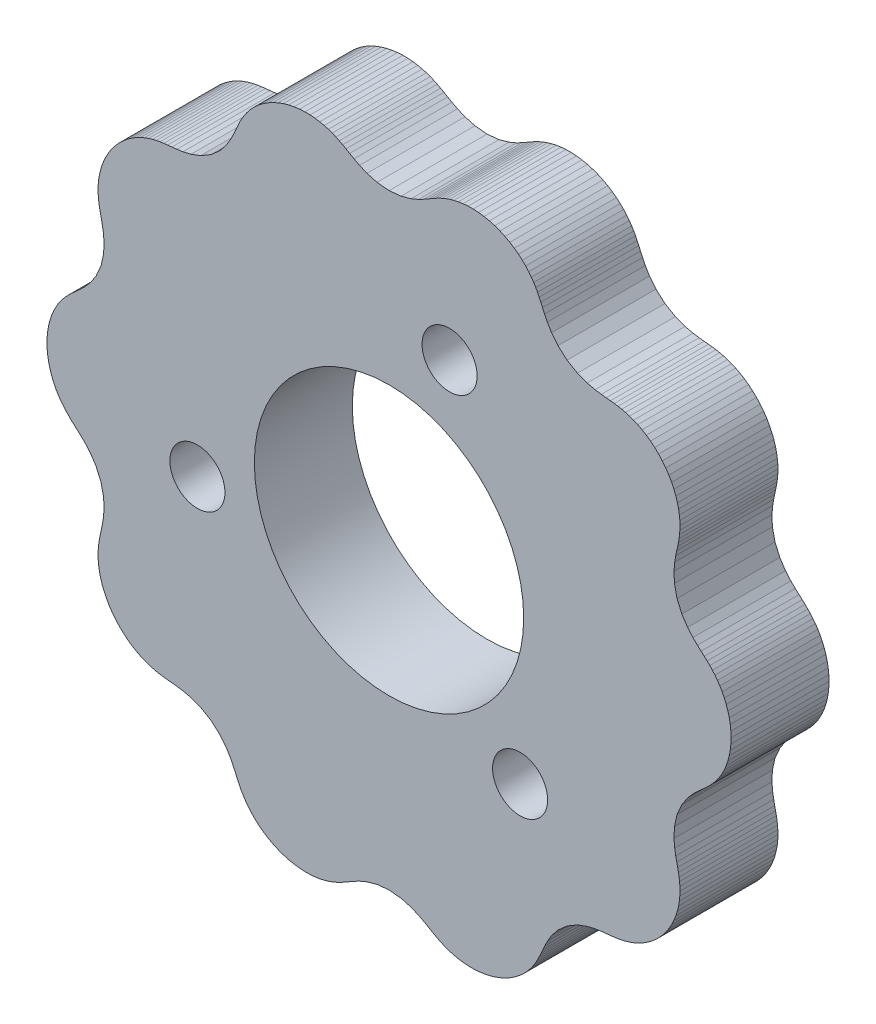
from build123d import *

# Parameters (mm, degrees)
MODEL_R             = 8.73125
BOSS_EXTRUDE1_DEPTH = 6.35
SKETCH2_R           = 1.78435
CUT_EXTRUDE1_DEPTH  = 33.323771723
SKETCH3_R           = 3.175
CUT_EXTRUDE2_DEPTH  = 3.81


with BuildPart() as part:
    # Model → Boss-Extrude1 (new body)
    with BuildSketch(Plane.XY):
        Polygon((20.890931284, -0.361246536), (20.90416592, 0), (20.890931284, 0.361246536), (20.851630676, 0.717938171), (20.787453815, 1.065699726), (20.70031633, 1.40051076), (20.592758773, 1.718871579), (20.467804656, 2.017956811), (20.328775926, 2.29575465), (20.179062376, 2.551192441), (20.021838, 2.784253604), (19.859711664, 2.996098554), (19.694291065, 3.189216289), (19.525628153, 3.36766), (19.351506826, 3.537471764), (19.166554614, 3.707500416), (18.961299064, 3.890989773), (18.721830857, 4.10851653), (18.432408361, 4.392542238), (18.086923383, 4.790426506), (17.715401805, 5.350520314), (17.403006197, 6.067227501), (17.234469638, 6.830677327), (17.205822028, 7.50217764), (17.251454741, 8.02714375), (17.318656337, 8.42704365), (17.384531166, 8.743782373), (17.442734057, 9.012874567), (17.492423206, 9.259142818), (17.533477467, 9.498869369), (17.565042048, 9.742370936), (17.585358367, 9.995838254), (17.59200199, 10.262519888), (17.582209268, 10.543484499), (17.553187508, 10.83813743), (17.502378641, 11.14459964), (17.427670756, 11.460010862), (17.327558853, 11.780790921), (17.201257572, 12.102876866), (17.048768629, 12.421944087), (16.870905406, 12.733613999), (16.669277065, 13.033647709), (16.446234634, 13.318123173), (16.204781691, 13.583592449), (15.948452407, 13.827215245), (15.681159712, 14.046864933), (15.407016027, 14.2412035), (15.130128134, 14.409722348), (14.854366055, 14.552746484), (14.583102683, 14.671400581), (14.318915576, 14.767536853), (14.063233278, 14.843627549), (13.815893445, 14.902631289), (13.574555701, 14.947857711), (13.333875739, 14.982892367), (13.084305922, 15.011736253), (12.810398356, 15.039536075), (12.488805487, 15.074763039), (12.087711646, 15.134426388), (11.574337923, 15.253250548), (10.944555773, 15.488001053), (10.270552502, 15.884207816), (9.685459013, 16.402788395), (9.267584629, 16.929204918), (8.995934932, 17.380733658), (8.815246902, 17.74375958), (8.682366407, 18.038726843), (8.571285112, 18.290637801), (8.466731632, 18.519079551), (8.359037495, 18.737153494), (8.241447148, 18.952703595), (8.108899044, 19.169704596), (7.957522317, 19.389359593), (7.784452983, 19.610908721), (7.587781239, 19.832229386), (7.366542034, 20.05029782), (7.120708021, 20.261558666), (6.851166002, 20.462230885), (6.559668751, 20.648565858), (6.248759598, 20.81706591), (5.92167025, 20.964666786), (5.582194105, 21.088884991), (5.234538506, 21.187929424), (4.883160046, 21.260776101), (4.532587413, 21.30720451), (4.187236233, 21.327794136), (3.851219989, 21.323879725), (3.528160084, 21.297463717), (3.220996399, 21.25108379), (2.931796592, 21.187632361), (2.66155725, 21.110122954), (2.409980937, 21.021395336), (2.17519728, 20.923747659), (1.95336752, 20.818481836), (1.738060486, 20.705357335), (1.519200252, 20.581999072), (1.281264051, 20.443490772), (1.000384065, 20.282962439), (0.640823095, 20.095474058), (0.155651939, 19.889851319), (-0.491835408, 19.709591807), (-1.27, 19.63396063), (-2.048164592, 19.709591807), (-2.695651939, 19.889851319), (-3.180823095, 20.095474058), (-3.540384065, 20.282962439), (-3.821264051, 20.443490772), (-4.059200252, 20.581999072), (-4.278060486, 20.705357335), (-4.49336752, 20.818481836), (-4.71519728, 20.923747659), (-4.949980937, 21.021395336), (-5.20155725, 21.110122954), (-5.471796592, 21.187632361), (-5.760996399, 21.25108379), (-6.068160084, 21.297463717), (-6.391219989, 21.323879725), (-6.727236233, 21.327794136), (-7.072587413, 21.30720451), (-7.423160046, 21.260776101), (-7.774538506, 21.187929424), (-8.122194105, 21.088884991), (-8.46167025, 20.964666786), (-8.788759598, 20.81706591), (-9.099668751, 20.648565858), (-9.391166002, 20.462230885), (-9.660708021, 20.261558666), (-9.906542034, 20.05029782), (-10.127781239, 19.832229386), (-10.324452983, 19.610908721), (-10.497522317, 19.389359593), (-10.648899044, 19.169704596), (-10.781447148, 18.952703595), (-10.899037495, 18.737153494), (-11.006731632, 18.519079551), (-11.111285112, 18.290637801), (-11.222366407, 18.038726843), (-11.355246902, 17.74375958), (-11.535934932, 17.380733658), (-11.807584629, 16.929204918), (-12.225459013, 16.402788395), (-12.810552502, 15.884207816), (-13.484555773, 15.488001053), (-14.114337923, 15.253250548), (-14.627711646, 15.134426388), (-15.028805487, 15.074763039), (-15.350398356, 15.039536075), (-15.624305922, 15.011736253), (-15.873875739, 14.982892367), (-16.114555701, 14.947857711), (-16.355893445, 14.902631289), (-16.603233278, 14.843627549), (-16.858915576, 14.767536853), (-17.123102683, 14.671400581), (-17.394366055, 14.552746484), (-17.670128134, 14.409722348), (-17.947016027, 14.2412035), (-18.221159712, 14.046864933), (-18.488452407, 13.827215245), (-18.744781691, 13.583592449), (-18.986234634, 13.318123173), (-19.209277065, 13.033647709), (-19.410905406, 12.733613999), (-19.588768629, 12.421944087), (-19.741257572, 12.102876866), (-19.867558853, 11.780790921), (-19.967670756, 11.460010862), (-20.042378641, 11.14459964), (-20.093187508, 10.83813743), (-20.122209268, 10.543484499), (-20.13200199, 10.262519888), (-20.125358367, 9.995838254), (-20.105042048, 9.742370936), (-20.073477467, 9.498869369), (-20.032423206, 9.259142818), (-19.982734057, 9.012874567), (-19.924531166, 8.743782373), (-19.858656337, 8.42704365), (-19.791454741, 8.02714375), (-19.745822028, 7.50217764), (-19.774469638, 6.830677327), (-19.943006197, 6.067227501), (-20.255401805, 5.350520314), (-20.626923383, 4.790426506), (-20.972408361, 4.392542238), (-21.261830857, 4.10851653), (-21.501299064, 3.890989773), (-21.706554614, 3.707500416), (-21.891506826, 3.537471764), (-22.065628153, 3.36766), (-22.234291065, 3.189216289), (-22.399711664, 2.996098554), (-22.561838, 2.784253604), (-22.719062376, 2.551192441), (-22.868775926, 2.29575465), (-23.007804656, 2.017956811), (-23.132758773, 1.718871579), (-23.24031633, 1.40051076), (-23.327453815, 1.065699726), (-23.391630676, 0.717938171), (-23.430931284, 0.361246536), (-23.44416592, 0), (-23.430931284, -0.361246536), (-23.391630676, -0.717938171), (-23.327453815, -1.065699726), (-23.24031633, -1.40051076), (-23.132758773, -1.718871579), (-23.007804656, -2.017956811), (-22.868775926, -2.29575465), (-22.719062376, -2.551192441), (-22.561838, -2.784253604), (-22.399711664, -2.996098554), (-22.234291065, -3.189216289), (-22.065628153, -3.36766), (-21.891506826, -3.537471764), (-21.706554614, -3.707500416), (-21.501299064, -3.890989773), (-21.261830857, -4.10851653), (-20.972408361, -4.392542238), (-20.626923383, -4.790426506), (-20.255401805, -5.350520314), (-19.943006197, -6.067227501), (-19.774469638, -6.830677327), (-19.745822028, -7.50217764), (-19.791454741, -8.02714375), (-19.858656337, -8.42704365), (-19.924531166, -8.743782373), (-19.982734057, -9.012874567), (-20.032423206, -9.259142818), (-20.073477467, -9.498869369), (-20.105042048, -9.742370936), (-20.125358367, -9.995838254), (-20.13200199, -10.262519888), (-20.122209268, -10.543484499), (-20.093187508, -10.83813743), (-20.042378641, -11.14459964), (-19.967670756, -11.460010862), (-19.867558853, -11.780790921), (-19.741257572, -12.102876866), (-19.588768629, -12.421944087), (-19.410905406, -12.733613999), (-19.209277065, -13.033647709), (-18.986234634, -13.318123173), (-18.744781691, -13.583592449), (-18.488452407, -13.827215245), (-18.221159712, -14.046864933), (-17.947016027, -14.2412035), (-17.670128134, -14.409722348), (-17.394366055, -14.552746484), (-17.123102683, -14.671400581), (-16.858915576, -14.767536853), (-16.603233278, -14.843627549), (-16.355893445, -14.902631289), (-16.114555701, -14.947857711), (-15.873875739, -14.982892367), (-15.624305922, -15.011736253), (-15.350398356, -15.039536075), (-15.028805487, -15.074763039), (-14.627711646, -15.134426388), (-14.114337923, -15.253250548), (-13.484555773, -15.488001053), (-12.810552502, -15.884207816), (-12.225459013, -16.402788395), (-11.807584629, -16.929204918), (-11.535934932, -17.380733658), (-11.355246902, -17.74375958), (-11.222366407, -18.038726843), (-11.111285112, -18.290637801), (-11.006731632, -18.519079551), (-10.899037495, -18.737153494), (-10.781447148, -18.952703595), (-10.648899044, -19.169704596), (-10.497522317, -19.389359593), (-10.324452983, -19.610908721), (-10.127781239, -19.832229386), (-9.906542034, -20.05029782), (-9.660708021, -20.261558666), (-9.391166002, -20.462230885), (-9.099668751, -20.648565858), (-8.788759598, -20.81706591), (-8.46167025, -20.964666786), (-8.122194105, -21.088884991), (-7.774538506, -21.187929424), (-7.423160046, -21.260776101), (-7.072587413, -21.30720451), (-6.727236233, -21.327794136), (-6.391219989, -21.323879725), (-6.068160084, -21.297463717), (-5.760996399, -21.25108379), (-5.471796592, -21.187632361), (-5.20155725, -21.110122954), (-4.949980937, -21.021395336), (-4.71519728, -20.923747659), (-4.49336752, -20.818481836), (-4.278060486, -20.705357335), (-4.059200252, -20.581999072), (-3.821264051, -20.443490772), (-3.540384065, -20.282962439), (-3.180823095, -20.095474058), (-2.695651939, -19.889851319), (-2.048164592, -19.709591807), (-1.27, -19.63396063), (-0.491835408, -19.709591807), (0.155651939, -19.889851319), (0.640823095, -20.095474058), (1.000384065, -20.282962439), (1.281264051, -20.443490772), (1.519200252, -20.581999072), (1.738060486, -20.705357335), (1.95336752, -20.818481836), (2.17519728, -20.923747659), (2.409980937, -21.021395336), (2.66155725, -21.110122954), (2.931796592, -21.187632361), (3.220996399, -21.25108379), (3.528160084, -21.297463717), (3.851219989, -21.323879725), (4.187236233, -21.327794136), (4.532587413, -21.30720451), (4.883160046, -21.260776101), (5.234538506, -21.187929424), (5.582194105, -21.088884991), (5.92167025, -20.964666786), (6.248759598, -20.81706591), (6.559668751, -20.648565858), (6.851166002, -20.462230885), (7.120708021, -20.261558666), (7.366542034, -20.05029782), (7.587781239, -19.832229386), (7.784452983, -19.610908721), (7.957522317, -19.389359593), (8.108899044, -19.169704596), (8.241447148, -18.952703595), (8.359037495, -18.737153494), (8.466731632, -18.519079551), (8.571285112, -18.290637801), (8.682366407, -18.038726843), (8.815246902, -17.74375958), (8.995934932, -17.380733658), (9.267584629, -16.929204918), (9.685459013, -16.402788395), (10.270552502, -15.884207816), (10.944555773, -15.488001053), (11.574337923, -15.253250548), (12.087711646, -15.134426388), (12.488805487, -15.074763039), (12.810398356, -15.039536075), (13.084305922, -15.011736253), (13.333875739, -14.982892367), (13.574555701, -14.947857711), (13.815893445, -14.902631289), (14.063233278, -14.843627549), (14.318915576, -14.767536853), (14.583102683, -14.671400581), (14.854366055, -14.552746484), (15.130128134, -14.409722348), (15.407016027, -14.2412035), (15.681159712, -14.046864933), (15.948452407, -13.827215245), (16.204781691, -13.583592449), (16.446234634, -13.318123173), (16.669277065, -13.033647709), (16.870905406, -12.733613999), (17.048768629, -12.421944087), (17.201257572, -12.102876866), (17.327558853, -11.780790921), (17.427670756, -11.460010862), (17.502378641, -11.14459964), (17.553187508, -10.83813743), (17.582209268, -10.543484499), (17.59200199, -10.262519888), (17.585358367, -9.995838254), (17.565042048, -9.742370936), (17.533477467, -9.498869369), (17.492423206, -9.259142818), (17.442734057, -9.012874567), (17.384531166, -8.743782373), (17.318656337, -8.42704365), (17.251454741, -8.02714375), (17.205822028, -7.50217764), (17.234469638, -6.830677327), (17.403006197, -6.067227501), (17.715401805, -5.350520314), (18.086923383, -4.790426506), (18.432408361, -4.392542238), (18.721830857, -4.10851653), (18.961299064, -3.890989773), (19.166554614, -3.707500416), (19.351506826, -3.537471764), (19.525628153, -3.36766), (19.694291065, -3.189216289), (19.859711664, -2.996098554), (20.021838, -2.784253604), (20.179062376, -2.551192441), (20.328775926, -2.29575465), (20.467804656, -2.017956811), (20.592758773, -1.718871579), (20.70031633, -1.40051076), (20.787453815, -1.065699726), (20.851630676, -0.717938171), align=None)
        with Locations((-1.27, 0)):
            Circle(MODEL_R, mode=Mode.SUBTRACT)
    extrude(amount=BOSS_EXTRUDE1_DEPTH)

    # Sketch2 → Cut-Extrude1 (cut, through all)
    with BuildSketch(Plane.XY.offset(6.35)):
        with Locations((2.654515829, 12.078417757)):
            Circle(SKETCH2_R)
        with Locations((7.227958701, -9.437939284)):
            Circle(SKETCH2_R)
        with Locations((-13.692474529, -2.640478473)):
            Circle(SKETCH2_R)
    extrude(amount=-CUT_EXTRUDE1_DEPTH, mode=Mode.SUBTRACT)

    # Sketch3 → Cut-Extrude2 (cut)
    with BuildSketch(Plane(origin=(0, 0, 0), x_dir=(-1, 0, 0), z_dir=(0, 0, -1))):
        with Locations((-2.654515829, 12.078417757)):
            Circle(SKETCH3_R)
        with Locations((13.692474529, -2.640478473)):
            Circle(SKETCH3_R)
        with Locations((-7.227958701, -9.437939284)):
            Circle(SKETCH3_R)
    extrude(amount=-CUT_EXTRUDE2_DEPTH, mode=Mode.SUBTRACT)


solid = part.part
